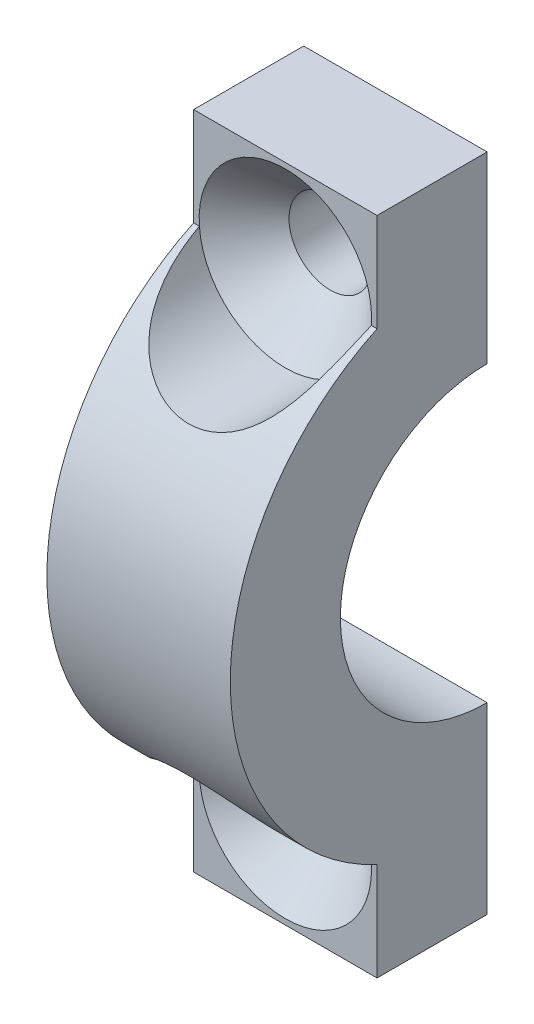
from build123d import *

# Parameters (mm, degrees)
EXTRUDE_1_DEPTH     = 5
CUT_EXTRUDE_1_REACH = 93.591
SKETCH_5_R          = 4.7


# Read off the part's stored shape, not the designer's step: 高级异型孔1
with BuildPart() as part:
    # 草图1 → 凸台-拉伸1 (new, symmetric)
    with BuildSketch(Plane(origin=(10, 0, 0), x_dir=(0, 0, -1), z_dir=(1, 0, 0))):
        with BuildLine():
            Line((-18, 80), (-18, 90))
            Line((-18, 90), (-24, 90))
            Line((-24, 90), (-24, 84.649110641))
            ThreePointArc((-24, 84.649110641), (-32, 72), (-24, 59.350889359))
            Line((-24, 59.350889359), (-24, 54))
            Line((-24, 54), (-18, 54))
            Line((-18, 54), (-18, 64))
            ThreePointArc((-18, 64), (-26, 72), (-18, 80))
        make_face()
    extrude(amount=EXTRUDE_1_DEPTH, both=True)

    # 高级异型孔1 outline → 高级异型孔1 (revolve, cut)
    with BuildSketch(Plane(origin=(10, 59, 0), x_dir=(1, 0, 0), z_dir=(0, -1, 0))):
        Polygon((0, 18), (2.25, 18), (2.25, 21.55), (4.7, 24), (0, 24), align=None)
    revolve(axis=Axis((10, 59, 0), (0, 0, 1)), mode=Mode.SUBTRACT)

    # Other 1 2 outline → Other 1 2 (revolve, cut)
    with BuildSketch(Plane(origin=(10, 85, 0), x_dir=(1, 0, 0), z_dir=(0, -1, 0))):
        Polygon((0, 18), (2.25, 18), (2.25, 21.55), (4.7, 24), (0, 24), align=None)
    revolve(axis=Axis((10, 85, 0), (0, 0, 1)), mode=Mode.SUBTRACT)

    # 草图5 → 切除-拉伸1 (cut, up to next)
    with BuildSketch(Plane.XY.offset(24), mode=Mode.PRIVATE) as cut_extrude_1_sk1:
        with Locations((10, 85)):
            Circle(SKETCH_5_R)
    cut_extrude_1_tool1 = extrude(cut_extrude_1_sk1.sketch, amount=CUT_EXTRUDE_1_REACH, mode=Mode.PRIVATE) & part.part
    # 草图5 → 切除-拉伸1 (cut, up to next)
    with BuildSketch(Plane.XY.offset(24), mode=Mode.PRIVATE) as cut_extrude_1_sk2:
        with Locations((10, 59)):
            Circle(SKETCH_5_R)
    cut_extrude_1_tool2 = extrude(cut_extrude_1_sk2.sketch, amount=CUT_EXTRUDE_1_REACH, mode=Mode.PRIVATE) & part.part
    add(cut_extrude_1_tool1.solids().sort_by_distance((10, 85, 24))[0], mode=Mode.SUBTRACT)
    add(cut_extrude_1_tool2.solids().sort_by_distance((10, 59, 24))[0], mode=Mode.SUBTRACT)


solid = part.part
